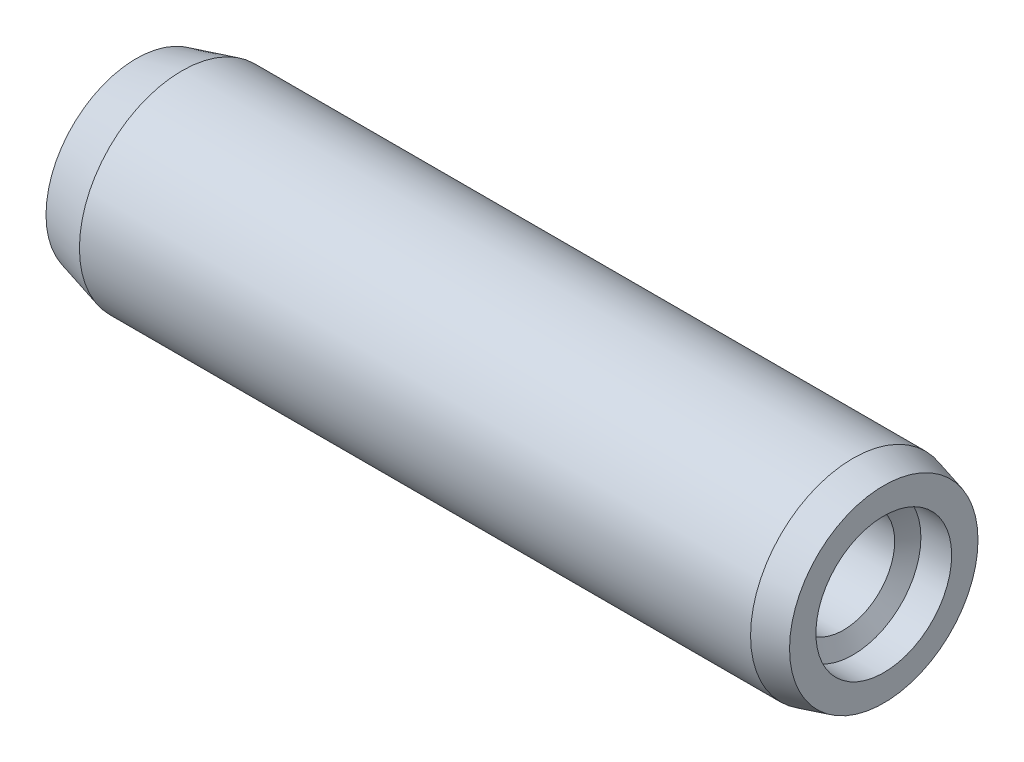
from build123d import *

# Parameters (mm, degrees)
PER_AGE1_D     = 4
PER_AGE1_DEPTH = 12
PER_AGE1_TIP   = 1.154700538
PER_AGE2_D     = 5.3
PER_AGE2_DEPTH = 1.2
PER_AGE2_TIP   = 1.529978213


with BuildPart() as part:
    # Esquisse1 → Base-Révolution (revolve)
    with BuildSketch(Plane.XY):
        with BuildLine():
            Line((0.817137041, 3.52228331), (2.6, 4))
            Line((2.6, 4), (28.8, 4))
            Line((28.8, 4), (30, 3.678460969))
            Line((30, 3.678460969), (30, 0))
            Line((30, 0), (0, 0))
            ThreePointArc((0, 0), (0.206961322, 1.807912654), (0.817137041, 3.52228331))
        make_face()
    revolve(axis=Axis((-7.062515413, 0, 0), (1, 0, 0)))

    # Perçage1
    with Locations(Plane(origin=(30, 0, 0), x_dir=(0, 0, -1), z_dir=(1, 0, 0))):
        with Locations((0, 0)):
            Hole(PER_AGE1_D / 2, depth=PER_AGE1_DEPTH)
            with Locations((0, 0, -(PER_AGE1_DEPTH + PER_AGE1_TIP / 2))):  # 120° drill point
                Cone(0, PER_AGE1_D / 2, PER_AGE1_TIP, mode=Mode.SUBTRACT)

    # Perçage2
    with Locations(Plane(origin=(30, 0, 0), x_dir=(0, 0, -1), z_dir=(1, 0, 0))):
        with Locations((0, 0)):
            Hole(PER_AGE2_D / 2, depth=PER_AGE2_DEPTH)
            with Locations((0, 0, -(PER_AGE2_DEPTH + PER_AGE2_TIP / 2))):  # 120° drill point
                Cone(0, PER_AGE2_D / 2, PER_AGE2_TIP, mode=Mode.SUBTRACT)


solid = part.part
